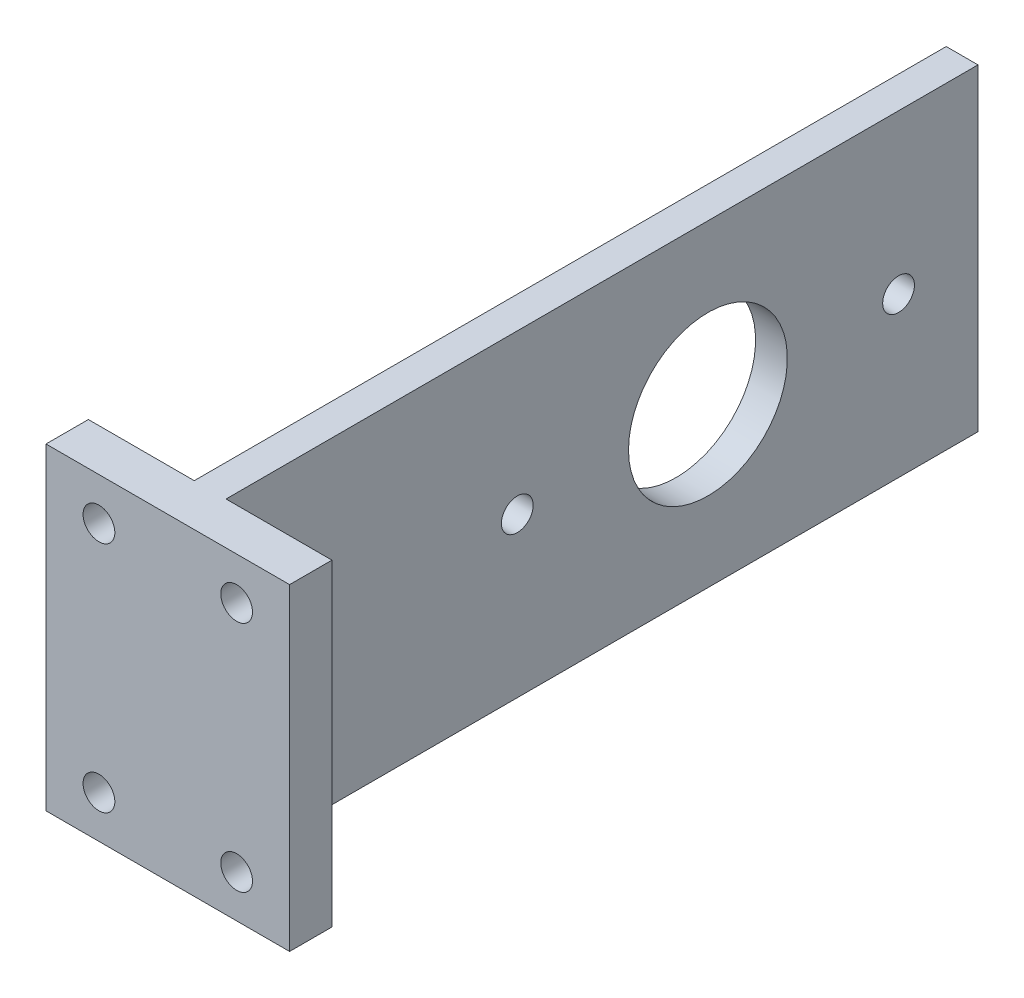
from build123d import *

# Parameters (mm, degrees)
BOSS_EXTRUDE1_DEPTH = 30
SKETCH2_R           = 1.5
SKETCH2_R_2         = 7.5
CUT_EXTRUDE1_DEPTH  = 82.816868676
SKETCH3_R           = 1.5
CUT_EXTRUDE2_DEPTH  = 82.591972644


with BuildPart() as part:
    # Sketch1 → Boss-Extrude1 (new body)
    with BuildSketch(Plane(origin=(0, 0, 0), x_dir=(1, 0, 0), z_dir=(0, 1, 0))):
        Polygon((-11.5, 4), (-1.5, 4), (-1.5, 75), (1.5, 75), (1.5, 4), (11.5, 4), (11.5, 0), (-11.5, 0), align=None)
    extrude(amount=BOSS_EXTRUDE1_DEPTH)

    # Sketch2 → Cut-Extrude1 (cut, through all)
    with BuildSketch(Plane.ZY.offset(1.5)):
        with Locations((-67.5, 15)):
            Circle(SKETCH2_R)
        with Locations((-31.5, 15)):
            Circle(SKETCH2_R)
        with Locations((-49.5, 15)):
            Circle(SKETCH2_R_2)
    extrude(amount=-CUT_EXTRUDE1_DEPTH, mode=Mode.SUBTRACT)

    # Sketch3 → Cut-Extrude2 (cut, through all)
    with BuildSketch(Plane.XY):
        with Locations((-6.5, 26)):
            Circle(SKETCH3_R)
        with Locations((-6.5, 4)):
            Circle(SKETCH3_R)
        with Locations((6.5, 4)):
            Circle(SKETCH3_R)
        with Locations((6.5, 26)):
            Circle(SKETCH3_R)
    extrude(amount=-CUT_EXTRUDE2_DEPTH, mode=Mode.SUBTRACT)


solid = part.part
